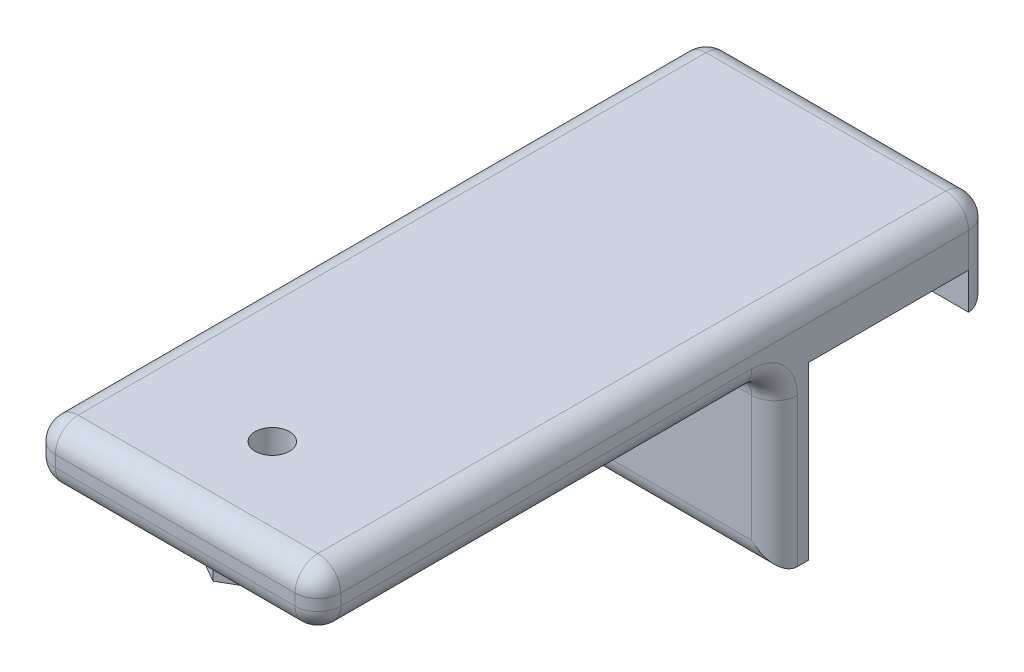
from build123d import *

# Parameters (mm, degrees)
SKETCH1_W            = 25
SKETCH1_H            = 14
BOSS_EXTRUDE1_DEPTH  = 5
SKETCH2_W            = 25
SKETCH2_H            = 5
SKETCH2_H_2          = 15
BOSS_EXTRUDE2_DEPTH  = 3
M6_CLEARANCE_HOLE1_D = 6.6
SKETCH10_W           = 25
SKETCH10_H           = 5
BOSS_EXTRUDE5_DEPTH  = 2
SKETCH5_W            = 25
SKETCH5_H            = 5
BOSS_EXTRUDE4_DEPTH  = 40
CUT_EXTRUDE1_REACH   = 57.283
SKETCH9_R            = 1.5
FILLET1_R            = 2
BOSS_EXTRUDE6_DEPTH  = 3


with BuildPart() as part:
    # Sketch1 → Boss-Extrude1 (new body)
    with BuildSketch(Plane(origin=(0, 0, 0), x_dir=(1, 0, 0), z_dir=(0, 1, 0))):
        Rectangle(SKETCH1_W, SKETCH1_H)
    extrude(amount=BOSS_EXTRUDE1_DEPTH)

    # Sketch2 → Boss-Extrude2 (add)
    with BuildSketch(Plane.XY.offset(7)):
        with Locations((0, 2.5)):
            Rectangle(SKETCH2_W, SKETCH2_H)
        with Locations((0, -7.5)):
            Rectangle(SKETCH2_W, SKETCH2_H_2)
    extrude(amount=BOSS_EXTRUDE2_DEPTH)

    # M6 Clearance Hole1 (through all)
    with Locations(Plane.XY.offset(10)):
        with Locations((0, -6.5)):
            Hole(M6_CLEARANCE_HOLE1_D / 2)

    # Sketch10 → Boss-Extrude5 (add)
    with BuildSketch(Plane(origin=(0, 0, -7), x_dir=(-1, 0, 0), z_dir=(0, 0, -1))):
        Polygon((-12.5, 0), (-12.5, -3.2), (1e-09, -3.2), (12.5, -3.2), (12.5, 0), align=None)
        with Locations((0, 2.5)):
            Rectangle(SKETCH10_W, SKETCH10_H)
    extrude(amount=BOSS_EXTRUDE5_DEPTH)

    # Sketch5 → Boss-Extrude4 (add)
    with BuildSketch(Plane.XY.offset(10)):
        with Locations((0, 2.5)):
            Rectangle(SKETCH5_W, SKETCH5_H)
    extrude(amount=BOSS_EXTRUDE4_DEPTH)

    # Sketch9 → Cut-Extrude1 (cut, up to next)
    with BuildSketch(Plane(origin=(0, 5, 0), x_dir=(1, 0, 0), z_dir=(0, 1, 0)), mode=Mode.PRIVATE) as cut_extrude1_sk1:
        with Locations(Location((0, -41.5, 0), (0, 0, 270))):
            Circle(SKETCH9_R)
    cut_extrude1_tool1 = extrude(cut_extrude1_sk1.sketch, amount=-CUT_EXTRUDE1_REACH, mode=Mode.PRIVATE) & part.part
    add(cut_extrude1_tool1.solids().sort_by_distance((0, 5, 41.5))[0], mode=Mode.SUBTRACT)

    # Fillet1
    fillet1_edges = [part.edges().sort_by_distance(p)[0] for p in [
        (12.5, 0, 30),
        (-12.5, 0, 30),
        (0, -15, 10),
        (0, -3.2, -9),
        (0, 5, -9),
        (12.5, 5, 20.5),
        (0, 0, 50),
        (0, 5, 50),
        (-12.5, 5, 20.5),
        (0, 0, 10),
        (12.5, -7.5, 10),
        (-12.5, -7.5, 10),
        (-12.5, 0.9, -9),
        (12.5, 0.9, -9),
        (-12.5, 2.5, 50),
        (12.5, 2.5, 50),
    ]]
    fillet(fillet1_edges, radius=FILLET1_R - 0.0001)  # a hair under: the kernel refuses the full size

    # Sketch11 → Boss-Extrude6 (add)
    with BuildSketch(Plane.XZ):
        Polygon((4.5, 38.901923789), (4.5, 44.098076211), (0, 46.696152423), (-4.5, 44.098076211), (-4.5, 38.901923789), (0, 36.303847577), align=None)
        Polygon((0, 44.964101615), (-3, 43.232050808), (-3, 39.767949192), (0, 38.035898385), (3, 39.767949192), (3, 43.232050808), align=None, mode=Mode.SUBTRACT)
    extrude(amount=BOSS_EXTRUDE6_DEPTH)


solid = part.part
